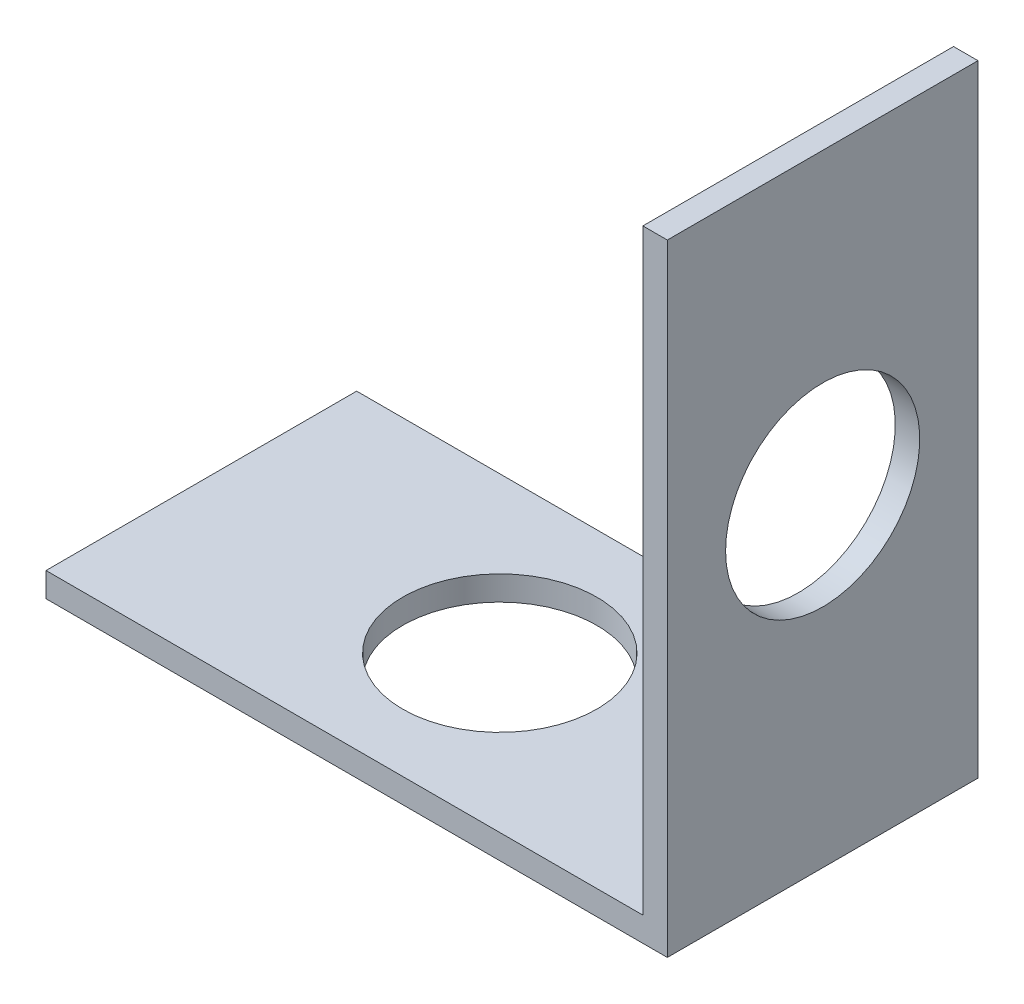
from build123d import *

# Parameters (mm, degrees)
BOSS_EXTRUDE1_DEPTH            = 6.35
F_5_16_0_3125_DIAMETER_HOLE1_D = 7.9375
F_5_16_0_3125_DIAMETER_HOLE2_D = 7.9375


with BuildPart() as part:
    # Sketch1 → Boss-Extrude1 (new, symmetric)
    with BuildSketch(Plane.XY):
        Polygon((0, 0), (0, 25.4), (-1, 25.4), (-1, 1), (-25.4, 1), (-25.4, 0), align=None)
    extrude(amount=BOSS_EXTRUDE1_DEPTH, both=True)

    # 5/16 (0.3125) Diameter Hole1 (through all)
    with Locations(Plane.ZY.offset(1)):
        with Locations((0, 13.2)):
            Hole(F_5_16_0_3125_DIAMETER_HOLE1_D / 2)

    # 5/16 (0.3125) Diameter Hole2 (through all)
    with Locations(Plane(origin=(-13.2, 1, 0), x_dir=(1, 0, 0), z_dir=(0, 1, 0))):
        with Locations((0, 0)):
            Hole(F_5_16_0_3125_DIAMETER_HOLE2_D / 2)


solid = part.part
